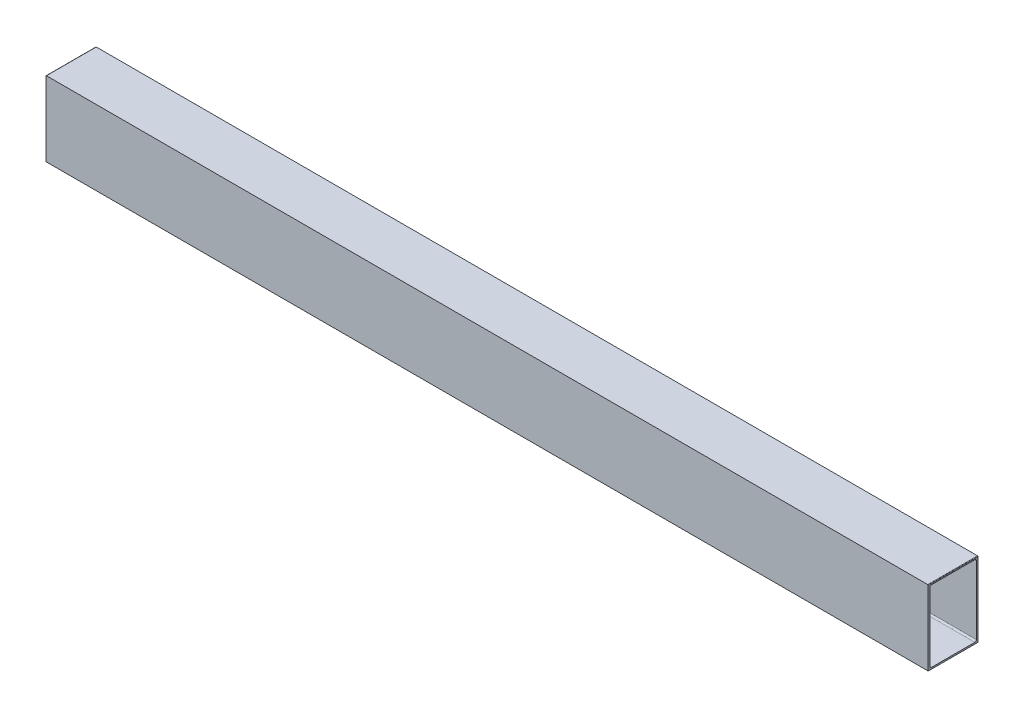
from build123d import *

# Parameters (mm, degrees)
SKETCH1_W           = 101.6
SKETCH1_H           = 152.4
BOSS_EXTRUDE1_DEPTH = 1800
FILLET1_R           = 1
FILLET2_R           = 1


with BuildPart() as part:
    # Sketch1 → Boss-Extrude1 (new body)
    with BuildSketch(Plane(origin=(0, 0, 0), x_dir=(0, 0, -1), z_dir=(1, 0, 0))):
        with Locations((-50.8, 76.2)):
            Rectangle(SKETCH1_W, SKETCH1_H)
        with BuildLine():
            Line((-98.425, 6.35), (-98.425, 146.05))
            ThreePointArc((-98.425, 146.05), (-97.49506403, 148.29506403), (-95.25, 149.225))
            Line((-95.25, 149.225), (-6.35, 149.225))
            ThreePointArc((-6.35, 149.225), (-4.10493597, 148.29506403), (-3.175, 146.05))
            Line((-3.175, 146.05), (-3.175, 6.35))
            ThreePointArc((-3.175, 6.35), (-4.10493597, 4.10493597), (-6.35, 3.175))
            Line((-6.35, 3.175), (-95.25, 3.175))
            ThreePointArc((-95.25, 3.175), (-97.49506403, 4.10493597), (-98.425, 6.35))
        make_face(mode=Mode.SUBTRACT)
    extrude(amount=BOSS_EXTRUDE1_DEPTH)

    # Fillet1
    fillet1_edges = [part.edges().sort_by_distance(p)[0] for p in [
        (0, 152.4, 50.8),
    ]]
    fillet(fillet1_edges, radius=FILLET1_R)

    # Fillet2
    fillet2_edges = [part.edges().sort_by_distance(p)[0] for p in [
        (1800, 152.4, 50.8),
    ]]
    fillet(fillet2_edges, radius=FILLET2_R)


solid = part.part
